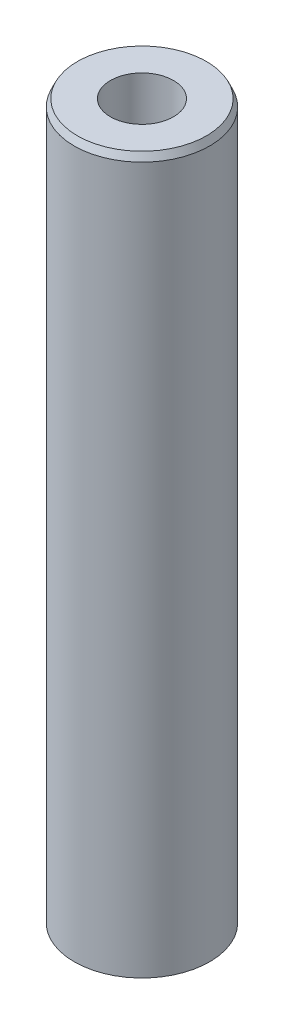
from build123d import *
from OCP.BRepFilletAPI import BRepFilletAPI_MakeChamfer

# Parameters (mm, degrees)
SKETCH1_R           = 50
BOSS_EXTRUDE1_DEPTH = 529.28719373
SKETCH2_R           = 23.269791355
CUT_EXTRUDE1_DEPTH  = 534.989637958
CHAMFER1_SIZE       = 5.283122727
CHAMFER1_SIZE2      = 2.401387956


with BuildPart() as part:
    # Sketch1 → Boss-Extrude1 (new body)
    with BuildSketch(Plane(origin=(0, 0, 0), x_dir=(1, 0, 0), z_dir=(0, 1, 0))):
        Circle(SKETCH1_R)
    extrude(amount=BOSS_EXTRUDE1_DEPTH)

    # Sketch2 → Cut-Extrude1 (cut, through all)
    with BuildSketch(Plane(origin=(0, 0, 0), x_dir=(1, 0, 0), z_dir=(0, 1, 0))):
        Circle(SKETCH2_R)
    extrude(amount=CUT_EXTRUDE1_DEPTH, mode=Mode.SUBTRACT)

    # Chamfer1: one chamfer whose edges measure the first distance from different faces: ONE call of the kernel's chamfer builder (chamfer() names one face for all edges)
    chamfer1_edges_1 = [part.edges().sort_by_distance(p)[0] for p in [
        (-50, 529.28719373, 0),
    ]]
    chamfer1_side_1 = [part.faces().sort_by_distance(p)[0] for p in [
        (-50, 264.643596865, 0),
    ]]
    chamfer1_edges_2 = [part.edges().sort_by_distance(p)[0] for p in [
        (-50, 0, 0),
    ]]
    chamfer1_side_2 = [part.faces().sort_by_distance(p)[0] for p in [
        (-48.585786438, 0, 0),
    ]]
    chamfer1 = BRepFilletAPI_MakeChamfer(part.part.solid().wrapped)
    for e in chamfer1_edges_1:
        chamfer1.Add(CHAMFER1_SIZE, CHAMFER1_SIZE2, e.wrapped, chamfer1_side_1[0].wrapped)  # the first distance lies on this face
    for e in chamfer1_edges_2:
        chamfer1.Add(CHAMFER1_SIZE, CHAMFER1_SIZE2, e.wrapped, chamfer1_side_2[0].wrapped)  # the first distance lies on this face
    add(Compound.cast(chamfer1.Shape()), mode=Mode.REPLACE)


solid = part.part
